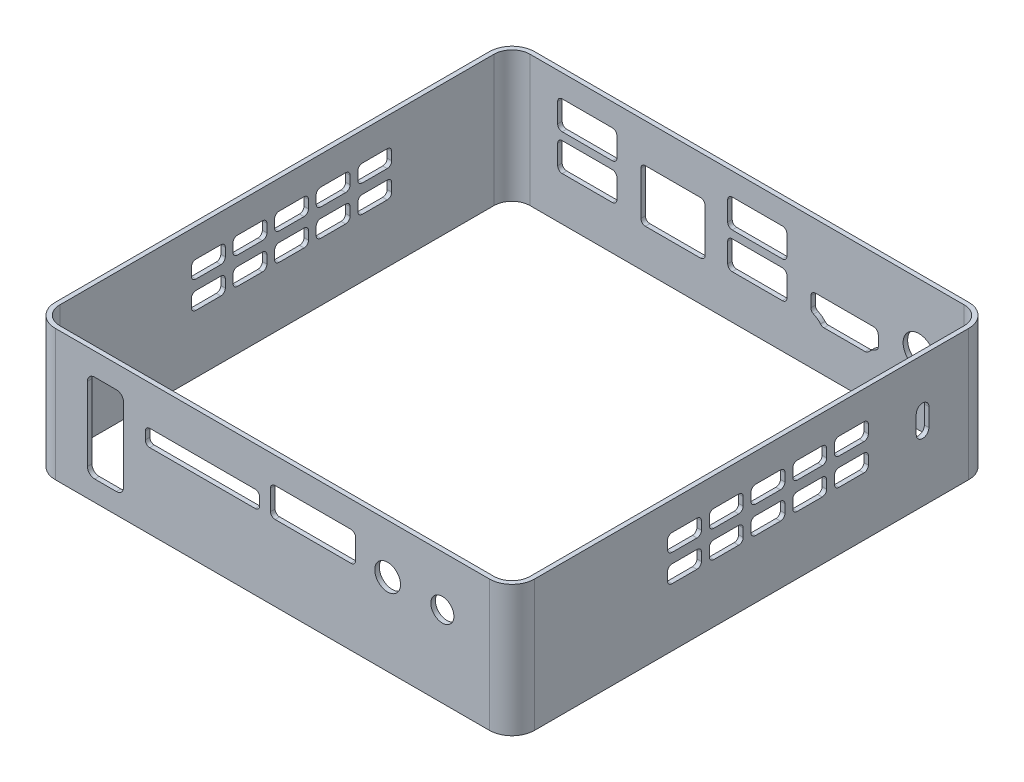
from build123d import *

# Parameters (mm, degrees)
BOSS_EXTRUDE1_DEPTH = 29
CUT_EXTRUDE2_DEPTH  = 2
CUT_EXTRUDE3_DEPTH  = 2
CUT_EXTRUDE4_DEPTH  = 2
SKETCH15_R          = 2.85
SKETCH15_R_2        = 2.55
CUT_EXTRUDE5_DEPTH  = 2
SKETCH16_R          = 3.5
CUT_EXTRUDE6_DEPTH  = 2
CUT_EXTRUDE7_REACH  = 154.686


with BuildPart() as part:
    # Sketch1 → Boss-Extrude1 (new body)
    with BuildSketch(Plane(origin=(0, 0, 0), x_dir=(1, 0, 0), z_dir=(0, 1, 0))):
        with BuildLine():
            Line((5, 0), (101, 0))
            ThreePointArc((101, 0), (104.535533906, 1.464466094), (106, 5))
            Line((106, 5), (106, 101))
            ThreePointArc((106, 101), (104.535533906, 104.535533906), (101, 106))
            Line((101, 106), (5, 106))
            ThreePointArc((5, 106), (1.464466094, 104.535533906), (0, 101))
            Line((0, 101), (0, 5))
            ThreePointArc((0, 5), (1.464466094, 1.464466094), (5, 0))
        make_face()
        with BuildLine():
            Line((1, 5), (1, 101))
            ThreePointArc((1, 101), (2.171572875, 103.828427125), (5, 105))
            Line((5, 105), (101, 105))
            ThreePointArc((101, 105), (103.828427125, 103.828427125), (105, 101))
            Line((105, 101), (105, 5))
            ThreePointArc((105, 5), (103.828427125, 2.171572875), (101, 1))
            Line((101, 1), (5, 1))
            ThreePointArc((5, 1), (2.171572875, 2.171572875), (1, 5))
        make_face(mode=Mode.SUBTRACT)
    extrude(amount=BOSS_EXTRUDE1_DEPTH)

    # Sketch12 → Cut-Extrude2 (cut)
    with BuildSketch(Plane(origin=(106, 0, 0), x_dir=(0, 0, -1), z_dir=(1, 0, 0))):
        with BuildLine():
            Line((44.63, 22.7), (50.13, 22.7))
            ThreePointArc((50.13, 22.7), (50.837106781, 22.407106781), (51.13, 21.7))
            Line((51.13, 21.7), (51.13, 19.9))
            ThreePointArc((51.13, 19.9), (50.837106781, 19.192893219), (50.13, 18.9))
            Line((50.13, 18.9), (44.63, 18.9))
            ThreePointArc((44.63, 18.9), (43.922893219, 19.192893219), (43.63, 19.9))
            Line((43.63, 19.9), (43.63, 21.7))
            ThreePointArc((43.63, 21.7), (43.922893219, 22.407106781), (44.63, 22.7))
        make_face()
        with BuildLine():
            Line((35.4, 22.7), (40.9, 22.7))
            ThreePointArc((40.9, 22.7), (41.607106781, 22.407106781), (41.9, 21.7))
            Line((41.9, 21.7), (41.9, 19.9))
            ThreePointArc((41.9, 19.9), (41.607106781, 19.192893219), (40.9, 18.9))
            Line((40.9, 18.9), (35.4, 18.9))
            ThreePointArc((35.4, 18.9), (34.692893219, 19.192893219), (34.4, 19.9))
            Line((34.4, 19.9), (34.4, 21.7))
            ThreePointArc((34.4, 21.7), (34.692893219, 22.407106781), (35.4, 22.7))
        make_face()
        with BuildLine():
            Line((53.86, 22.7), (59.36, 22.7))
            ThreePointArc((59.36, 22.7), (60.067106781, 22.407106781), (60.36, 21.7))
            Line((60.36, 21.7), (60.36, 19.9))
            ThreePointArc((60.36, 19.9), (60.067106781, 19.192893219), (59.36, 18.9))
            Line((59.36, 18.9), (53.86, 18.9))
            ThreePointArc((53.86, 18.9), (53.152893219, 19.192893219), (52.86, 19.9))
            Line((52.86, 19.9), (52.86, 21.7))
            ThreePointArc((52.86, 21.7), (53.152893219, 22.407106781), (53.86, 22.7))
        make_face()
        with BuildLine():
            Line((63.09, 22.7), (68.59, 22.7))
            ThreePointArc((68.59, 22.7), (69.297106781, 22.407106781), (69.59, 21.7))
            Line((69.59, 21.7), (69.59, 19.9))
            ThreePointArc((69.59, 19.9), (69.297106781, 19.192893219), (68.59, 18.9))
            Line((68.59, 18.9), (63.09, 18.9))
            ThreePointArc((63.09, 18.9), (62.382893219, 19.192893219), (62.09, 19.9))
            Line((62.09, 19.9), (62.09, 21.7))
            ThreePointArc((62.09, 21.7), (62.382893219, 22.407106781), (63.09, 22.7))
        make_face()
        with BuildLine():
            Line((72.32, 22.7), (77.82, 22.7))
            ThreePointArc((77.82, 22.7), (78.527106781, 22.407106781), (78.82, 21.7))
            Line((78.82, 21.7), (78.82, 19.9))
            ThreePointArc((78.82, 19.9), (78.527106781, 19.192893219), (77.82, 18.9))
            Line((77.82, 18.9), (72.32, 18.9))
            ThreePointArc((72.32, 18.9), (71.612893219, 19.192893219), (71.32, 19.9))
            Line((71.32, 19.9), (71.32, 21.7))
            ThreePointArc((71.32, 21.7), (71.612893219, 22.407106781), (72.32, 22.7))
        make_face()
        with BuildLine():
            Line((44.63, 16.7), (50.13, 16.7))
            ThreePointArc((50.13, 16.7), (50.837106781, 16.407106781), (51.13, 15.7))
            Line((51.13, 15.7), (51.13, 13.9))
            ThreePointArc((51.13, 13.9), (50.837106781, 13.192893219), (50.13, 12.9))
            Line((50.13, 12.9), (44.63, 12.9))
            ThreePointArc((44.63, 12.9), (43.922893219, 13.192893219), (43.63, 13.9))
            Line((43.63, 13.9), (43.63, 15.7))
            ThreePointArc((43.63, 15.7), (43.922893219, 16.407106781), (44.63, 16.7))
        make_face()
        with BuildLine():
            Line((53.86, 16.7), (59.36, 16.7))
            ThreePointArc((59.36, 16.7), (60.067106781, 16.407106781), (60.36, 15.7))
            Line((60.36, 15.7), (60.36, 13.9))
            ThreePointArc((60.36, 13.9), (60.067106781, 13.192893219), (59.36, 12.9))
            Line((59.36, 12.9), (53.86, 12.9))
            ThreePointArc((53.86, 12.9), (53.152893219, 13.192893219), (52.86, 13.9))
            Line((52.86, 13.9), (52.86, 15.7))
            ThreePointArc((52.86, 15.7), (53.152893219, 16.407106781), (53.86, 16.7))
        make_face()
        with BuildLine():
            Line((63.09, 16.7), (68.59, 16.7))
            ThreePointArc((68.59, 16.7), (69.297106781, 16.407106781), (69.59, 15.7))
            Line((69.59, 15.7), (69.59, 13.9))
            ThreePointArc((69.59, 13.9), (69.297106781, 13.192893219), (68.59, 12.9))
            Line((68.59, 12.9), (63.09, 12.9))
            ThreePointArc((63.09, 12.9), (62.382893219, 13.192893219), (62.09, 13.9))
            Line((62.09, 13.9), (62.09, 15.7))
            ThreePointArc((62.09, 15.7), (62.382893219, 16.407106781), (63.09, 16.7))
        make_face()
        with BuildLine():
            Line((72.32, 16.7), (77.82, 16.7))
            ThreePointArc((77.82, 16.7), (78.527106781, 16.407106781), (78.82, 15.7))
            Line((78.82, 15.7), (78.82, 13.9))
            ThreePointArc((78.82, 13.9), (78.527106781, 13.192893219), (77.82, 12.9))
            Line((77.82, 12.9), (72.32, 12.9))
            ThreePointArc((72.32, 12.9), (71.612893219, 13.192893219), (71.32, 13.9))
            Line((71.32, 13.9), (71.32, 15.7))
            ThreePointArc((71.32, 15.7), (71.612893219, 16.407106781), (72.32, 16.7))
        make_face()
        with BuildLine():
            Line((35.4, 16.7), (40.9, 16.7))
            ThreePointArc((40.9, 16.7), (41.607106781, 16.407106781), (41.9, 15.7))
            Line((41.9, 15.7), (41.9, 13.9))
            ThreePointArc((41.9, 13.9), (41.607106781, 13.192893219), (40.9, 12.9))
            Line((40.9, 12.9), (35.4, 12.9))
            ThreePointArc((35.4, 12.9), (34.692893219, 13.192893219), (34.4, 13.9))
            Line((34.4, 13.9), (34.4, 15.7))
            ThreePointArc((34.4, 15.7), (34.692893219, 16.407106781), (35.4, 16.7))
        make_face()
    extrude(amount=-CUT_EXTRUDE2_DEPTH, mode=Mode.SUBTRACT)

    # Sketch13 → Cut-Extrude3 (cut)
    with BuildSketch(Plane(origin=(106, 0, 0), x_dir=(0, 0, -1), z_dir=(1, 0, 0))):
        with BuildLine():
            Line((89.4, 14.4), (89.4, 18.4))
            ThreePointArc((89.4, 18.4), (90.8, 19.8), (92.2, 18.4))
            Line((92.2, 18.4), (92.2, 14.4))
            ThreePointArc((92.2, 14.4), (90.8, 13), (89.4, 14.4))
        make_face()
    extrude(amount=-CUT_EXTRUDE3_DEPTH, mode=Mode.SUBTRACT)

    # Sketch14 → Cut-Extrude4 (cut)
    with BuildSketch(Plane.ZY):
        with BuildLine():
            Line((-68.2, 22.7), (-62.7, 22.7))
            ThreePointArc((-62.7, 22.7), (-61.992893219, 22.407106781), (-61.7, 21.7))
            Line((-61.7, 21.7), (-61.7, 19.9))
            ThreePointArc((-61.7, 19.9), (-61.992893219, 19.192893219), (-62.7, 18.9))
            Line((-62.7, 18.9), (-68.2, 18.9))
            ThreePointArc((-68.2, 18.9), (-68.907106781, 19.192893219), (-69.2, 19.9))
            Line((-69.2, 19.9), (-69.2, 21.7))
            ThreePointArc((-69.2, 21.7), (-68.907106781, 22.407106781), (-68.2, 22.7))
        make_face()
        with BuildLine():
            Line((-77.4, 22.7), (-71.9, 22.7))
            ThreePointArc((-71.9, 22.7), (-71.192893219, 22.407106781), (-70.9, 21.7))
            Line((-70.9, 21.7), (-70.9, 19.9))
            ThreePointArc((-70.9, 19.9), (-71.192893219, 19.192893219), (-71.9, 18.9))
            Line((-71.9, 18.9), (-77.4, 18.9))
            ThreePointArc((-77.4, 18.9), (-78.107106781, 19.192893219), (-78.4, 19.9))
            Line((-78.4, 19.9), (-78.4, 21.7))
            ThreePointArc((-78.4, 21.7), (-78.107106781, 22.407106781), (-77.4, 22.7))
        make_face()
        with BuildLine():
            Line((-59, 22.7), (-53.5, 22.7))
            ThreePointArc((-53.5, 22.7), (-52.792893219, 22.407106781), (-52.5, 21.7))
            Line((-52.5, 21.7), (-52.5, 19.9))
            ThreePointArc((-52.5, 19.9), (-52.792893219, 19.192893219), (-53.5, 18.9))
            Line((-53.5, 18.9), (-59, 18.9))
            ThreePointArc((-59, 18.9), (-59.707106781, 19.192893219), (-60, 19.9))
            Line((-60, 19.9), (-60, 21.7))
            ThreePointArc((-60, 21.7), (-59.707106781, 22.407106781), (-59, 22.7))
        make_face()
        with BuildLine():
            Line((-49.8, 22.7), (-44.3, 22.7))
            ThreePointArc((-44.3, 22.7), (-43.592893219, 22.407106781), (-43.3, 21.7))
            Line((-43.3, 21.7), (-43.3, 19.9))
            ThreePointArc((-43.3, 19.9), (-43.592893219, 19.192893219), (-44.3, 18.9))
            Line((-44.3, 18.9), (-49.8, 18.9))
            ThreePointArc((-49.8, 18.9), (-50.507106781, 19.192893219), (-50.8, 19.9))
            Line((-50.8, 19.9), (-50.8, 21.7))
            ThreePointArc((-50.8, 21.7), (-50.507106781, 22.407106781), (-49.8, 22.7))
        make_face()
        with BuildLine():
            Line((-40.6, 22.7), (-35.1, 22.7))
            ThreePointArc((-35.1, 22.7), (-34.392893219, 22.407106781), (-34.1, 21.7))
            Line((-34.1, 21.7), (-34.1, 19.9))
            ThreePointArc((-34.1, 19.9), (-34.392893219, 19.192893219), (-35.1, 18.9))
            Line((-35.1, 18.9), (-40.6, 18.9))
            ThreePointArc((-40.6, 18.9), (-41.307106781, 19.192893219), (-41.6, 19.9))
            Line((-41.6, 19.9), (-41.6, 21.7))
            ThreePointArc((-41.6, 21.7), (-41.307106781, 22.407106781), (-40.6, 22.7))
        make_face()
        with BuildLine():
            Line((-68.2, 16.7), (-62.7, 16.7))
            ThreePointArc((-62.7, 16.7), (-61.992893219, 16.407106781), (-61.7, 15.7))
            Line((-61.7, 15.7), (-61.7, 13.9))
            ThreePointArc((-61.7, 13.9), (-61.992893219, 13.192893219), (-62.7, 12.9))
            Line((-62.7, 12.9), (-68.2, 12.9))
            ThreePointArc((-68.2, 12.9), (-68.907106781, 13.192893219), (-69.2, 13.9))
            Line((-69.2, 13.9), (-69.2, 15.7))
            ThreePointArc((-69.2, 15.7), (-68.907106781, 16.407106781), (-68.2, 16.7))
        make_face()
        with BuildLine():
            Line((-59, 16.7), (-53.5, 16.7))
            ThreePointArc((-53.5, 16.7), (-52.792893219, 16.407106781), (-52.5, 15.7))
            Line((-52.5, 15.7), (-52.5, 13.9))
            ThreePointArc((-52.5, 13.9), (-52.792893219, 13.192893219), (-53.5, 12.9))
            Line((-53.5, 12.9), (-59, 12.9))
            ThreePointArc((-59, 12.9), (-59.707106781, 13.192893219), (-60, 13.9))
            Line((-60, 13.9), (-60, 15.7))
            ThreePointArc((-60, 15.7), (-59.707106781, 16.407106781), (-59, 16.7))
        make_face()
        with BuildLine():
            Line((-49.8, 16.7), (-44.3, 16.7))
            ThreePointArc((-44.3, 16.7), (-43.592893219, 16.407106781), (-43.3, 15.7))
            Line((-43.3, 15.7), (-43.3, 13.9))
            ThreePointArc((-43.3, 13.9), (-43.592893219, 13.192893219), (-44.3, 12.9))
            Line((-44.3, 12.9), (-49.8, 12.9))
            ThreePointArc((-49.8, 12.9), (-50.507106781, 13.192893219), (-50.8, 13.9))
            Line((-50.8, 13.9), (-50.8, 15.7))
            ThreePointArc((-50.8, 15.7), (-50.507106781, 16.407106781), (-49.8, 16.7))
        make_face()
        with BuildLine():
            Line((-40.6, 16.7), (-35.1, 16.7))
            ThreePointArc((-35.1, 16.7), (-34.392893219, 16.407106781), (-34.1, 15.7))
            Line((-34.1, 15.7), (-34.1, 13.9))
            ThreePointArc((-34.1, 13.9), (-34.392893219, 13.192893219), (-35.1, 12.9))
            Line((-35.1, 12.9), (-40.6, 12.9))
            ThreePointArc((-40.6, 12.9), (-41.307106781, 13.192893219), (-41.6, 13.9))
            Line((-41.6, 13.9), (-41.6, 15.7))
            ThreePointArc((-41.6, 15.7), (-41.307106781, 16.407106781), (-40.6, 16.7))
        make_face()
        with BuildLine():
            Line((-77.4, 16.7), (-71.9, 16.7))
            ThreePointArc((-71.9, 16.7), (-71.192893219, 16.407106781), (-70.9, 15.7))
            Line((-70.9, 15.7), (-70.9, 13.9))
            ThreePointArc((-70.9, 13.9), (-71.192893219, 13.192893219), (-71.9, 12.9))
            Line((-71.9, 12.9), (-77.4, 12.9))
            ThreePointArc((-77.4, 12.9), (-78.107106781, 13.192893219), (-78.4, 13.9))
            Line((-78.4, 13.9), (-78.4, 15.7))
            ThreePointArc((-78.4, 15.7), (-78.107106781, 16.407106781), (-77.4, 16.7))
        make_face()
    extrude(amount=-CUT_EXTRUDE4_DEPTH, mode=Mode.SUBTRACT)

    # Sketch15 → Cut-Extrude5 (cut)
    with BuildSketch(Plane.XY):
        with Locations((78.5, 18.1)):
            Circle(SKETCH15_R)
        with Locations((90.6, 17.9)):
            Circle(SKETCH15_R_2)
        with BuildLine():
            Line((49.2, 20.3), (25.9, 20.3))
            ThreePointArc((25.9, 20.3), (25.192893219, 20.007106781), (24.9, 19.3))
            Line((24.9, 19.3), (24.9, 17.6))
            ThreePointArc((24.9, 17.6), (25.192893219, 16.892893219), (25.9, 16.6))
            Line((25.9, 16.6), (49.2, 16.6))
            ThreePointArc((49.2, 16.6), (49.907106781, 16.892893219), (50.2, 17.6))
            Line((50.2, 17.6), (50.2, 19.3))
            ThreePointArc((50.2, 19.3), (49.907106781, 20.007106781), (49.2, 20.3))
        make_face()
        with BuildLine():
            Line((53.6, 23.2), (70.4, 23.2))
            ThreePointArc((70.4, 23.2), (71.107106781, 22.907106781), (71.4, 22.2))
            Line((71.4, 22.2), (71.4, 17.7))
            ThreePointArc((71.4, 17.7), (71.107106781, 16.992893219), (70.4, 16.7))
            Line((70.4, 16.7), (53.6, 16.7))
            ThreePointArc((53.6, 16.7), (52.892893219, 16.992893219), (52.6, 17.7))
            Line((52.6, 17.7), (52.6, 22.2))
            ThreePointArc((52.6, 22.2), (52.892893219, 22.907106781), (53.6, 23.2))
        make_face()
    extrude(amount=-CUT_EXTRUDE5_DEPTH, mode=Mode.SUBTRACT)

    # Sketch16 → Cut-Extrude6 (cut)
    with BuildSketch(Plane(origin=(0, 0, -106), x_dir=(-1, 0, 0), z_dir=(0, 0, -1))):
        with Locations((-91, 15)):
            Circle(SKETCH16_R)
        with BuildLine():
            Line((-81, 14.8), (-68.1, 14.8))
            ThreePointArc((-68.1, 14.8), (-67.392893219, 14.507106781), (-67.1, 13.8))
            Line((-67.1, 13.8), (-67.1, 11.492950037))
            ThreePointArc((-67.1, 11.492950037), (-67.264533252, 10.943409035), (-67.703990626, 10.574703569))
            ThreePointArc((-67.703990626, 10.574703569), (-68.531910525, 10.099506781), (-69.231139826, 9.449628539))
            ThreePointArc((-69.231139826, 9.449628539), (-69.572648188, 9.191602658), (-69.990756152, 9.1))
            Line((-69.990756152, 9.1), (-79.109243848, 9.1))
            ThreePointArc((-79.109243848, 9.1), (-79.527351812, 9.191602658), (-79.868860174, 9.449628539))
            ThreePointArc((-79.868860174, 9.449628539), (-80.568089475, 10.099506781), (-81.396009374, 10.574703569))
            ThreePointArc((-81.396009374, 10.574703569), (-81.835466748, 10.943409035), (-82, 11.492950037))
            Line((-82, 11.492950037), (-82, 13.8))
            ThreePointArc((-82, 13.8), (-81.707106781, 14.507106781), (-81, 14.8))
        make_face()
        with BuildLine():
            Line((-24.2, 23), (-24.2, 18.7))
            ThreePointArc((-24.2, 18.7), (-23.907106781, 17.992893219), (-23.2, 17.7))
            Line((-23.2, 17.7), (-12.1, 17.7))
            ThreePointArc((-12.1, 17.7), (-11.392893219, 17.992893219), (-11.1, 18.7))
            Line((-11.1, 18.7), (-11.1, 23))
            ThreePointArc((-11.1, 23), (-11.392893219, 23.707106781), (-12.1, 24))
            Line((-12.1, 24), (-23.2, 24))
            ThreePointArc((-23.2, 24), (-23.907106781, 23.707106781), (-24.2, 23))
        make_face()
        with BuildLine():
            Line((-60.8, 24), (-49.7, 24))
            ThreePointArc((-49.7, 24), (-48.992893219, 23.707106781), (-48.7, 23))
            Line((-48.7, 23), (-48.7, 18.7))
            ThreePointArc((-48.7, 18.7), (-48.992893219, 17.992893219), (-49.7, 17.7))
            Line((-49.7, 17.7), (-60.8, 17.7))
            ThreePointArc((-60.8, 17.7), (-61.507106781, 17.992893219), (-61.8, 18.7))
            Line((-61.8, 18.7), (-61.8, 23))
            ThreePointArc((-61.8, 23), (-61.507106781, 23.707106781), (-60.8, 24))
        make_face()
        with BuildLine():
            Line((-42.7, 20.4), (-30.5, 20.4))
            ThreePointArc((-30.5, 20.4), (-29.792893219, 20.107106781), (-29.5, 19.4))
            Line((-29.5, 19.4), (-29.5, 9.8))
            ThreePointArc((-29.5, 9.8), (-29.792893219, 9.092893219), (-30.5, 8.8))
            Line((-30.5, 8.8), (-42.7, 8.8))
            ThreePointArc((-42.7, 8.8), (-43.407106781, 9.092893219), (-43.7, 9.8))
            Line((-43.7, 9.8), (-43.7, 19.4))
            ThreePointArc((-43.7, 19.4), (-43.407106781, 20.107106781), (-42.7, 20.4))
        make_face()
        with BuildLine():
            Line((-24.2, 15), (-24.2, 10.7))
            ThreePointArc((-24.2, 10.7), (-23.907106781, 9.992893219), (-23.2, 9.7))
            Line((-23.2, 9.7), (-12.1, 9.7))
            ThreePointArc((-12.1, 9.7), (-11.392893219, 9.992893219), (-11.1, 10.7))
            Line((-11.1, 10.7), (-11.1, 15))
            ThreePointArc((-11.1, 15), (-11.392893219, 15.707106781), (-12.1, 16))
            Line((-12.1, 16), (-23.2, 16))
            ThreePointArc((-23.2, 16), (-23.907106781, 15.707106781), (-24.2, 15))
        make_face()
        with BuildLine():
            Line((-61.8, 15), (-61.8, 10.7))
            ThreePointArc((-61.8, 10.7), (-61.507106781, 9.992893219), (-60.8, 9.7))
            Line((-60.8, 9.7), (-49.7, 9.7))
            ThreePointArc((-49.7, 9.7), (-48.992893219, 9.992893219), (-48.7, 10.7))
            Line((-48.7, 10.7), (-48.7, 15))
            ThreePointArc((-48.7, 15), (-48.992893219, 15.707106781), (-49.7, 16))
            Line((-49.7, 16), (-60.8, 16))
            ThreePointArc((-60.8, 16), (-61.507106781, 15.707106781), (-61.8, 15))
        make_face()
    extrude(amount=-CUT_EXTRUDE6_DEPTH, mode=Mode.SUBTRACT)

    # Sketch17 → Cut-Extrude7 (cut, up to next)
    with BuildSketch(Plane.XY, mode=Mode.PRIVATE) as cut_extrude7_sk1:
        with BuildLine():
            Line((13.7, 24), (18.5, 24))
            ThreePointArc((18.5, 24), (19.63137085, 23.53137085), (20.1, 22.4))
            Line((20.1, 22.4), (20.1, 6.1))
            ThreePointArc((20.1, 6.1), (19.63137085, 4.96862915), (18.5, 4.5))
            Line((18.5, 4.5), (13.7, 4.5))
            ThreePointArc((13.7, 4.5), (12.56862915, 4.96862915), (12.1, 6.1))
            Line((12.1, 6.1), (12.1, 22.4))
            ThreePointArc((12.1, 22.4), (12.56862915, 23.53137085), (13.7, 24))
        make_face()
    cut_extrude7_tool1 = extrude(cut_extrude7_sk1.sketch, amount=-CUT_EXTRUDE7_REACH, mode=Mode.PRIVATE) & part.part
    add(cut_extrude7_tool1.solids().sort_by_distance((16.1, 14.25, 0))[0], mode=Mode.SUBTRACT)


solid = part.part
